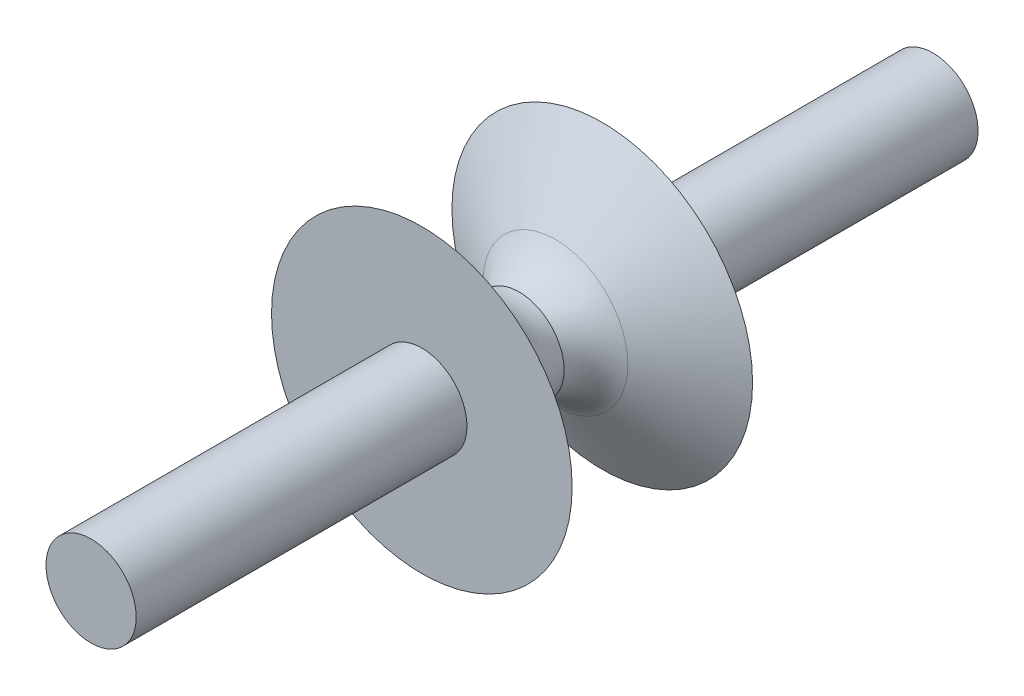
from build123d import *

# Parameters (mm, degrees)
SKETCH1_R           = 0.75
BOSS_EXTRUDE1_DEPTH = 10
FILLET3_R           = 1
BOSS_EXTRUDE3_START = 2
SKETCH4_R           = 0.75
BOSS_EXTRUDE3_DEPTH = 2
SKETCH5_R           = 0.75
BOSS_EXTRUDE4_DEPTH = 2


with BuildPart() as part:
    # Sketch1 → Boss-Extrude1 (new body)
    with BuildSketch(Plane.XY):
        Circle(SKETCH1_R)
    extrude(amount=BOSS_EXTRUDE1_DEPTH)

    # Sketch3 → Revolve1 (revolve)
    with BuildSketch(Plane(origin=(0, 0, 0), x_dir=(0, 0, -1), z_dir=(1, 0, 0)), mode=Mode.PRIVATE) as revolve1_sk:
        Polygon((-3.5, 0), (-3.5, 2.5), (-5, 0), align=None)
    revolve1 = revolve(revolve1_sk.sketch.rotate(Axis((0, 0, 5), (0, 0, -1)), 270), axis=Axis((0, 0, 5), (0, 0, -1)))

    # Mirror1: Revolve1 across plane
    add(revolve1.mirror(Plane(origin=(0, 0, 5), x_dir=(1, 0, 0), z_dir=(0, 0, -1))))

    # Fillet3
    fillet3_edges = [part.edges().sort_by_distance(p)[0] for p in [
        (0, -0.75, 5.45),
    ]]
    fillet(fillet3_edges, radius=FILLET3_R)

    # Fillet4: read off the stored shape, not the designer's step
    # Fillet4 outline → Fillet4 (revolve)
    with BuildSketch(Plane.XZ):
        with BuildLine():
            Line((0.75, 4.883809621), (0.75, 4.278013821))
            Line((0.75, 4.278013821), (1.203310298, 4.278013821))
            ThreePointArc((1.203310298, 4.278013821), (0.917148948, 4.536383889), (0.75, 4.883809621))
        make_face()
    revolve(axis=Axis((0, 0, 0), (0, 0, 1)))

    # Sketch4 → Boss-Extrude3 (add)
    with BuildSketch(Plane(origin=(0, 0, 0), x_dir=(-1, 0, 0), z_dir=(0, 0, -1)).offset(BOSS_EXTRUDE3_START)):
        Circle(SKETCH4_R)
    extrude(amount=-BOSS_EXTRUDE3_DEPTH)

    # Sketch5 → Boss-Extrude4 (add)
    with BuildSketch(Plane.XY.offset(10)):
        with Locations(Location((0, 0, 0), (0, 0, 180))):
            Circle(SKETCH5_R)
    extrude(amount=BOSS_EXTRUDE4_DEPTH)


solid = part.part
